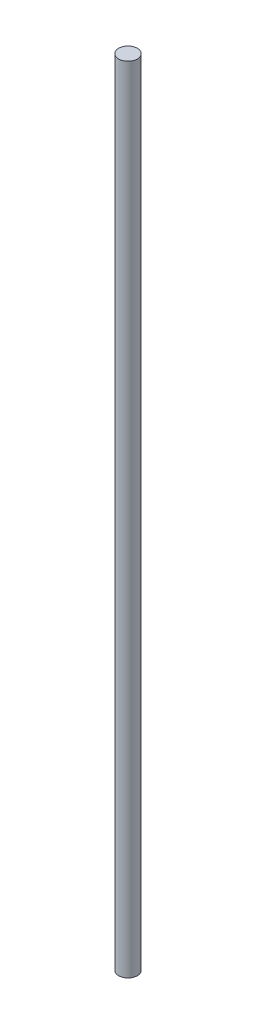
from build123d import *

# Parameters (mm, degrees)
BOSS_EXTRUDE1_DEPTH      = 170
BOSS_EXTRUDE1_DEPTH_BACK = 170
SKETCH1_R                = 4


with BuildPart() as part:
    # Sketch1 → Boss-Extrude1 (new, two sides: drawn at the far end of the back side and taken through both)
    with BuildSketch(Plane(origin=(0, 0, 0), x_dir=(1, 0, 0), z_dir=(0, 1, 0)).offset(-BOSS_EXTRUDE1_DEPTH_BACK)):
        Circle(SKETCH1_R)
    extrude(amount=BOSS_EXTRUDE1_DEPTH + BOSS_EXTRUDE1_DEPTH_BACK)


solid = part.part
